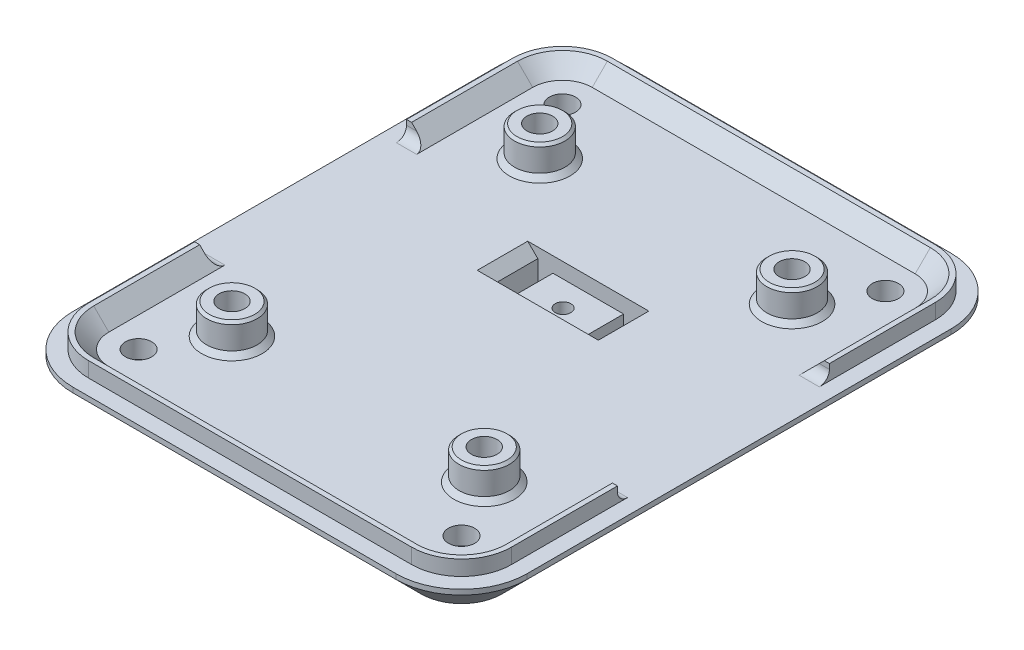
from build123d import *

# Parameters (mm, degrees)
BOSS_EXTRUDE1_DEPTH          = 6
CHAMFER1_SIZE                = 5
BOSS_EXTRUDE2_DEPTH          = 3
CHAMFER2_SIZE                = 3
SKETCH3_R                    = 2.55
CUT_EXTRUDE1_DEPTH           = 72.316197319
BOSS_EXTRUDE3_START          = 6
SKETCH4_R                    = 5
SKETCH4_R_2                  = 2.55
BOSS_EXTRUDE3_DEPTH          = 6
CHAMFER3_SIZE                = 1
CHAMFER4_SIZE                = 0.5
SKETCH5_R                    = 4.1
CUT_EXTRUDE2_DEPTH           = 5
SKETCH6_R                    = 2.6
CUT_EXTRUDE3_DEPTH           = 10
SKETCH7_R                    = 5
CUT_EXTRUDE4_DEPTH           = 2.8
CUT_EXTRUDE4_DRAFT           = -45
CUT_EXTRUDE4_PROFILE_2_DEPTH = 2.8
CUT_EXTRUDE4_PROFILE_2_DRAFT = -45
CUT_EXTRUDE4_PROFILE_3_DEPTH = 2.8
CUT_EXTRUDE4_PROFILE_3_DRAFT = -45
CUT_EXTRUDE4_PROFILE_4_DEPTH = 2.8
CUT_EXTRUDE4_PROFILE_4_DRAFT = -45
FILLET1_R                    = 2
CUT_EXTRUDE5_START           = -3
SKETCH8_W                    = 20
SKETCH8_H                    = 10
CUT_EXTRUDE5_DEPTH           = 10
CHAMFER5_SIZE                = 2
SKETCH9_R                    = 1.55
SKETCH9_W                    = 3
SKETCH9_H                    = 10
CUT_EXTRUDE6_DEPTH           = 10


with BuildPart() as part:
    # Sketch1 → Boss-Extrude1 (new body)
    with BuildSketch(Plane(origin=(0, 0, 0), x_dir=(1, 0, 0), z_dir=(0, 1, 0))):
        with BuildLine():
            Line((-32, -55), (32, -55))
            ThreePointArc((32, -55), (41.192388155, -51.192388155), (45, -42))
            Line((45, -42), (45, 42))
            ThreePointArc((45, 42), (41.192388155, 51.192388155), (32, 55))
            Line((32, 55), (-32, 55))
            ThreePointArc((-32, 55), (-41.192388155, 51.192388155), (-45, 42))
            Line((-45, 42), (-45, -42))
            ThreePointArc((-45, -42), (-41.192388155, -51.192388155), (-32, -55))
        make_face()
    extrude(amount=BOSS_EXTRUDE1_DEPTH)

    # Chamfer1
    chamfer1_edges = [part.edges().sort_by_distance(p)[0] for p in [
        (45, 0, 0),
        (41.192388155, 0, 51.192388155),
        (0, 0, 55),
        (-41.192388155, 0, 51.192388155),
        (-45, 0, 0),
        (-41.192388155, 0, -51.192388155),
        (0, 0, -55),
        (41.192388155, 0, -51.192388155),
    ]]
    chamfer(chamfer1_edges, length=CHAMFER1_SIZE)

    # Sketch2 → Boss-Extrude2 (add)
    with BuildSketch(Plane(origin=(0, 6, 0), x_dir=(1, 0, 0), z_dir=(0, 1, 0))):
        with BuildLine():
            ThreePointArc((-37.9, -42), (-36.171930009, -46.171930009), (-32, -47.9))
            Line((-32, -47.9), (32, -47.9))
            ThreePointArc((32, -47.9), (36.171930009, -46.171930009), (37.9, -42))
            Line((37.9, -42), (37.9, -21))
            Line((37.9, -21), (41.9, -21))
            Line((41.9, -21), (41.9, -42))
            ThreePointArc((41.9, -42), (39.000357134, -49.000357134), (32, -51.9))
            Line((32, -51.9), (-32, -51.9))
            ThreePointArc((-32, -51.9), (-39.000357134, -49.000357134), (-41.9, -42))
            Line((-41.9, -42), (-41.9, -21))
            Line((-41.9, -21), (-37.9, -21))
            Line((-37.9, -21), (-37.9, -42))
        make_face()
        with BuildLine():
            ThreePointArc((-41.9, 42), (-39.000357134, 49.000357134), (-32, 51.9))
            Line((-32, 51.9), (32, 51.9))
            ThreePointArc((32, 51.9), (39.000357134, 49.000357134), (41.9, 42))
            Line((41.9, 42), (41.9, 21))
            Line((41.9, 21), (37.9, 21))
            Line((37.9, 21), (37.9, 42))
            ThreePointArc((37.9, 42), (36.171930009, 46.171930009), (32, 47.9))
            Line((32, 47.9), (-32, 47.9))
            ThreePointArc((-32, 47.9), (-36.171930009, 46.171930009), (-37.9, 42))
            Line((-37.9, 42), (-37.9, 21))
            Line((-37.9, 21), (-41.9, 21))
            Line((-41.9, 21), (-41.9, 42))
        make_face()
    extrude(amount=BOSS_EXTRUDE2_DEPTH)

    # Chamfer2
    chamfer2_edges = [part.edges().sort_by_distance(p)[0] for p in [
        (37.9, 9, 31.5),
        (36.171930009, 9, 46.171930009),
        (0, 9, 47.9),
        (-36.171930009, 9, 46.171930009),
        (-37.9, 9, 31.5),
        (-37.9, 9, -31.5),
        (-36.171930009, 9, -46.171930009),
        (0, 9, -47.9),
        (36.171930009, 9, -46.171930009),
        (37.9, 9, -31.5),
    ]]
    chamfer(chamfer2_edges, length=CHAMFER2_SIZE - 0.0001)  # a hair under: the kernel refuses the full size

    # Sketch3 → Cut-Extrude1 (cut, through all)
    with BuildSketch(Plane(origin=(0, 6, 0), x_dir=(1, 0, 0), z_dir=(0, 1, 0))):
        with Locations(Location((-25, 30.5, 0), (0, 0, 270))):
            Circle(SKETCH3_R)
        with Locations(Location((25, 30.5, 0), (0, 0, 90))):
            Circle(SKETCH3_R)
        with Locations(Location((25, -30.5, 0), (0, 0, 270))):
            Circle(SKETCH3_R)
        with Locations(Location((-25, -30.5, 0), (0, 0, 90))):
            Circle(SKETCH3_R)
    extrude(amount=-CUT_EXTRUDE1_DEPTH, mode=Mode.SUBTRACT)

    # Sketch4 → Boss-Extrude3 (add)
    # profile 1 of 4: a face of its own
    with BuildSketch(Plane(origin=(0, 6, 0), x_dir=(1, 0, 0), z_dir=(0, 1, 0)).offset(BOSS_EXTRUDE3_START)):
        with Locations(Location((-25, -30.5, 0), (0, 0, 90))):
            Circle(SKETCH4_R)
        with Locations(Location((-25, -30.5, 0), (0, 0, 270))):
            Circle(SKETCH4_R_2, mode=Mode.SUBTRACT)
    # profile 2 of 4: a face of its own
    with BuildSketch(Plane(origin=(0, 6, 0), x_dir=(1, 0, 0), z_dir=(0, 1, 0)).offset(BOSS_EXTRUDE3_START)):
        with Locations(Location((25, -30.5, 0), (0, 0, 90))):
            Circle(SKETCH4_R)
        with Locations(Location((25, -30.5, 0), (0, 0, 270))):
            Circle(SKETCH4_R_2, mode=Mode.SUBTRACT)
    # profile 3 of 4: a face of its own
    with BuildSketch(Plane(origin=(0, 6, 0), x_dir=(1, 0, 0), z_dir=(0, 1, 0)).offset(BOSS_EXTRUDE3_START)):
        with Locations(Location((-25, 30.5, 0), (0, 0, 90))):
            Circle(SKETCH4_R)
        with Locations(Location((-25, 30.5, 0), (0, 0, 270))):
            Circle(SKETCH4_R_2, mode=Mode.SUBTRACT)
    # profile 4 of 4: a face of its own
    with BuildSketch(Plane(origin=(0, 6, 0), x_dir=(1, 0, 0), z_dir=(0, 1, 0)).offset(BOSS_EXTRUDE3_START)):
        with Locations(Location((25, 30.5, 0), (0, 0, 90))):
            Circle(SKETCH4_R)
        with Locations(Location((25, 30.5, 0), (0, 0, 270))):
            Circle(SKETCH4_R_2, mode=Mode.SUBTRACT)
    extrude(amount=-BOSS_EXTRUDE3_DEPTH)

    # Chamfer3
    chamfer3_edges = [part.edges().sort_by_distance(p)[0] for p in [
        (-25, 6, 35.5),
        (25, 6, 35.5),
        (-25, 6, -25.5),
        (25, 6, -25.5),
    ]]
    chamfer(chamfer3_edges, length=CHAMFER3_SIZE)

    # Chamfer4
    chamfer4_edges = [part.edges().sort_by_distance(p)[0] for p in [
        (-25, 12, 35.5),
        (25, 12, 35.5),
        (-25, 12, -25.5),
        (25, 12, -25.5),
    ]]
    chamfer(chamfer4_edges, length=CHAMFER4_SIZE)

    # Sketch5 → Cut-Extrude2 (cut)
    with BuildSketch(Plane.XZ):
        with Locations(Location((-25, 30.5, 0), (0, 0, 270))):
            Circle(SKETCH5_R)
        with Locations(Location((25, 30.5, 0), (0, 0, 270))):
            Circle(SKETCH5_R)
        with Locations(Location((-25, -30.5, 0), (0, 0, 270))):
            Circle(SKETCH5_R)
        with Locations(Location((25, -30.5, 0), (0, 0, 270))):
            Circle(SKETCH5_R)
    extrude(amount=-CUT_EXTRUDE2_DEPTH, mode=Mode.SUBTRACT)

    # Sketch6 → Cut-Extrude3 (cut)
    with BuildSketch(Plane(origin=(0, 6, 0), x_dir=(1, 0, 0), z_dir=(0, 1, 0))):
        with Locations(Location((-32, 42, 0), (0, 0, 270))):
            Circle(SKETCH6_R)
        with Locations(Location((32, 42, 0), (0, 0, 270))):
            Circle(SKETCH6_R)
        with Locations(Location((32, -42, 0), (0, 0, 270))):
            Circle(SKETCH6_R)
        with Locations(Location((-32, -42, 0), (0, 0, 270))):
            Circle(SKETCH6_R)
    extrude(amount=-CUT_EXTRUDE3_DEPTH, mode=Mode.SUBTRACT)


with BuildPart() as cut_extrude4_tool:
    # Sketch7 → Cut-Extrude4 (with draft: the straight prism first)
    with BuildSketch(Plane.XZ):
        with Locations((32, 42)):
            Circle(SKETCH7_R)
    extrude(amount=-CUT_EXTRUDE4_DEPTH)
    # Cut-Extrude4: the draft: its side faces are tilted about the plane it starts from
    cut_extrude4_sides = [cut_extrude4_tool.faces().sort_by_distance(p)[0] for p in [
        (27, 1.4, 42),
    ]]
    draft(cut_extrude4_sides, Plane.XZ, CUT_EXTRUDE4_DRAFT)


with BuildPart() as part_1:
    add(part.part)

    # Cut-Extrude4: cut by cut_extrude4_tool
    add(cut_extrude4_tool.part, mode=Mode.SUBTRACT)


with BuildPart() as cut_extrude4_profile_2_tool:
    # Sketch7 → Cut-Extrude4 profile 2 (with draft: the straight prism first)
    with BuildSketch(Plane.XZ):
        with Locations((-32, 42)):
            Circle(SKETCH7_R)
    extrude(amount=-CUT_EXTRUDE4_PROFILE_2_DEPTH)
    # Cut-Extrude4 profile 2: the draft: its side faces are tilted about the plane it starts from
    cut_extrude4_profile_2_sides = [cut_extrude4_profile_2_tool.faces().sort_by_distance(p)[0] for p in [
        (-37, 1.4, 42),
    ]]
    draft(cut_extrude4_profile_2_sides, Plane.XZ, CUT_EXTRUDE4_PROFILE_2_DRAFT)


with BuildPart() as part_2:
    add(part_1.part)

    # Cut-Extrude4 profile 2: cut by cut_extrude4_profile_2_tool
    add(cut_extrude4_profile_2_tool.part, mode=Mode.SUBTRACT)


with BuildPart() as cut_extrude4_profile_3_tool:
    # Sketch7 → Cut-Extrude4 profile 3 (with draft: the straight prism first)
    with BuildSketch(Plane.XZ):
        with Locations((-32, -42)):
            Circle(SKETCH7_R)
    extrude(amount=-CUT_EXTRUDE4_PROFILE_3_DEPTH)
    # Cut-Extrude4 profile 3: the draft: its side faces are tilted about the plane it starts from
    cut_extrude4_profile_3_sides = [cut_extrude4_profile_3_tool.faces().sort_by_distance(p)[0] for p in [
        (-37, 1.4, -42),
    ]]
    draft(cut_extrude4_profile_3_sides, Plane.XZ, CUT_EXTRUDE4_PROFILE_3_DRAFT)


with BuildPart() as part_3:
    add(part_2.part)

    # Cut-Extrude4 profile 3: cut by cut_extrude4_profile_3_tool
    add(cut_extrude4_profile_3_tool.part, mode=Mode.SUBTRACT)


with BuildPart() as cut_extrude4_profile_4_tool:
    # Sketch7 → Cut-Extrude4 profile 4 (with draft: the straight prism first)
    with BuildSketch(Plane.XZ):
        with Locations((32, -42)):
            Circle(SKETCH7_R)
    extrude(amount=-CUT_EXTRUDE4_PROFILE_4_DEPTH)
    # Cut-Extrude4 profile 4: the draft: its side faces are tilted about the plane it starts from
    cut_extrude4_profile_4_sides = [cut_extrude4_profile_4_tool.faces().sort_by_distance(p)[0] for p in [
        (27, 1.4, -42),
    ]]
    draft(cut_extrude4_profile_4_sides, Plane.XZ, CUT_EXTRUDE4_PROFILE_4_DRAFT)


with BuildPart() as part_4:
    add(part_3.part)

    # Cut-Extrude4 profile 4: cut by cut_extrude4_profile_4_tool
    add(cut_extrude4_profile_4_tool.part, mode=Mode.SUBTRACT)

    # Fillet1
    fillet1_edges = [part_4.edges().sort_by_distance(p)[0] for p in [
        (39.9, 6, 21),
        (-39.9, 6, 21),
        (-39.9, 6, -21),
        (39.9, 6, -21),
    ]]
    fillet(fillet1_edges, radius=FILLET1_R)

    # Sketch8 → Cut-Extrude5 (cut)
    with BuildSketch(Plane.XZ.offset(CUT_EXTRUDE5_START)):
        with Locations((0, -10.11628608)):
            Rectangle(SKETCH8_W, SKETCH8_H)
    extrude(amount=-CUT_EXTRUDE5_DEPTH, mode=Mode.SUBTRACT)

    # Chamfer5
    chamfer5_edges = [part_4.edges().sort_by_distance(p)[0] for p in [
        (-10, 6, -10.11628608),
        (10, 6, -10.11628608),
    ]]
    chamfer(chamfer5_edges, length=CHAMFER5_SIZE)

    # Sketch9 → Cut-Extrude6 (cut)
    with BuildSketch(Plane(origin=(0, 3, 0), x_dir=(1, 0, 0), z_dir=(0, 1, 0))):
        with Locations(Location((0, 10.11628608, 0), (0, 0, 270))):
            Circle(SKETCH9_R)
        with Locations((-8.5, 10.11628608)):
            Rectangle(SKETCH9_W, SKETCH9_H)
        with Locations((8.5, 10.11628608)):
            Rectangle(SKETCH9_W, SKETCH9_H)
    extrude(amount=-CUT_EXTRUDE6_DEPTH, mode=Mode.SUBTRACT)


solid = part_4.part
